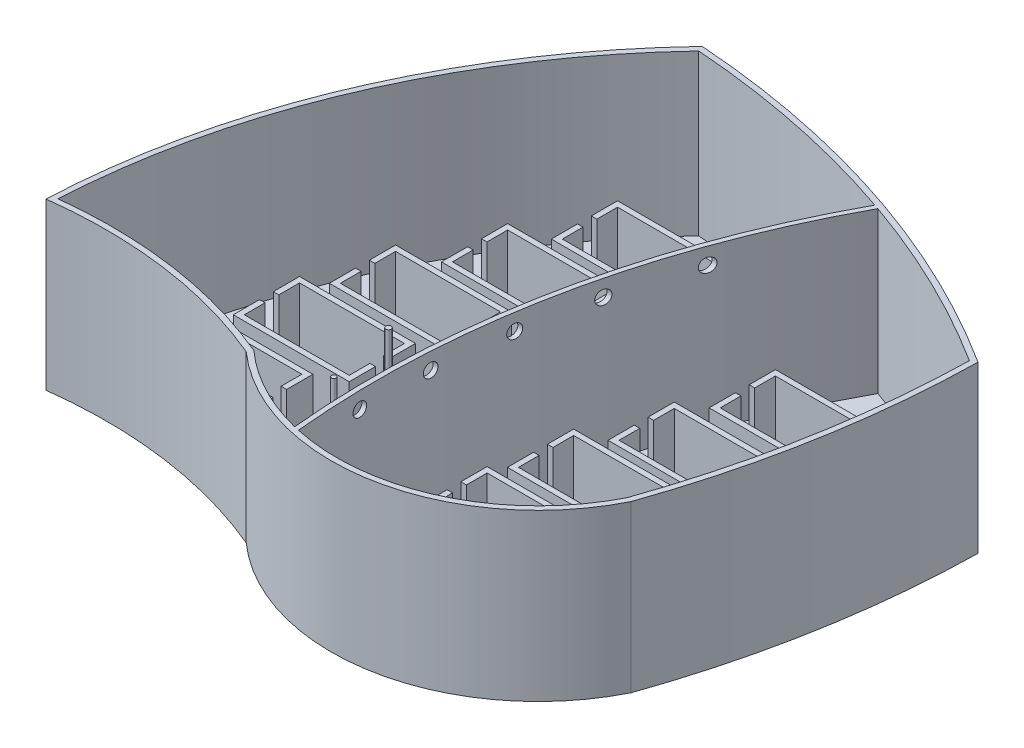
from build123d import *

# Parameters (mm, degrees)
BOSS_EXTRUDE1_DEPTH                 = 38.1
CUT_EXTRUDE1_DEPTH                  = 36.83
BOSS_EXTRUDE2_DEPTH                 = 13.97
BOSS_EXTRUDE3_DEPTH                 = 13.97
BOSS_EXTRUDE4_DEPTH                 = 13.97
BOSS_EXTRUDE5_DEPTH                 = 13.97
BOSS_EXTRUDE6_DEPTH                 = 13.97
BOSS_EXTRUDE7_DEPTH                 = 13.97
BOSS_EXTRUDE8_DEPTH                 = 13.97
BOSS_EXTRUDE9_DEPTH                 = 13.97
BOSS_EXTRUDE10_DEPTH                = 13.97
BOSS_EXTRUDE11_DEPTH                = 13.97
SKETCH23_R                          = 0.528906431
SKETCH23_R_2                        = 0.615796914
DIVIDER_FOR_BACK_RANK_TENDONS_DEPTH = 36.83
SKETCH24_R                          = 1.5875
BACK_RANK_HOLES_DEPTH               = 25.4


with BuildPart() as part:
    # Sketch2 → Boss-Extrude1 (new body)
    with BuildSketch(Plane(origin=(0, 0, 0), x_dir=(1, 0, 0), z_dir=(0, 1, 0))):
        with BuildLine():
            ThreePointArc((69.85, 32.318633901), (24.487599366, 53.834392461), (-24.779542712, 63.5))
            ThreePointArc((-24.779542712, 63.5), (-56.921960183, 14.649560977), (-69.85, -42.379959275))
            ThreePointArc((-69.85, -42.379959275), (-42.648219696, -42.533803265), (-16.422067996, -49.755263412))
            ThreePointArc((-16.422067996, -49.755263412), (24.190420795, -60.863388539), (57.709194094, -35.382875864))
            ThreePointArc((57.709194094, -35.382875864), (66.491147348, -2.018379058), (69.85, 32.318633901))
        make_face()
    extrude(amount=BOSS_EXTRUDE1_DEPTH)

    # Sketch3 → Cut-Extrude1 (cut)
    with BuildSketch(Plane(origin=(0, 38.1, 0), x_dir=(1, 0, 0), z_dir=(0, 1, 0))):
        with BuildLine():
            ThreePointArc((-68.509424991, -40.941161108), (-55.576860209, 14.565343441), (-24.271393384, 62.190872582))
            ThreePointArc((-24.271393384, 62.190872582), (24.035828478, 52.646076911), (68.566503666, 31.629184282))
            ThreePointArc((68.566503666, 31.629184282), (65.177968079, -2.144518661), (56.510759544, -34.962572841))
            ThreePointArc((56.510759544, -34.962572841), (23.756832183, -59.663746327), (-15.762594325, -48.65544684))
            ThreePointArc((-15.762594325, -48.65544684), (-41.638215999, -41.394613893), (-68.509424991, -40.941161108))
        make_face()
    extrude(amount=-CUT_EXTRUDE1_DEPTH, mode=Mode.SUBTRACT)

    # Sketch6 → Boss-Extrude2 (add)
    with BuildSketch(Plane(origin=(0, 0, 0), x_dir=(1, 0, 0), z_dir=(0, 1, 0))):
        Polygon((-55.045108711, -31.662350048), (-53.775108711, -31.662350048), (-53.775108711, -36.424850048), (-29.645108711, -36.424850048), (-29.645108711, -31.662350048), (-28.375108711, -31.662350048), (-28.375108711, -37.694850048), (-55.045108711, -37.694850048), align=None)
        Polygon((-29.645108711, -23.724850048), (-53.775108711, -23.724850048), (-53.775108711, -28.487350048), (-55.045108711, -28.487350048), (-55.045108711, -22.454850048), (-28.375108711, -22.454850048), (-28.375108711, -28.487350048), (-29.645108711, -28.487350048), align=None)
    extrude(amount=BOSS_EXTRUDE2_DEPTH)

    # Sketch7 → Boss-Extrude3 (add)
    with BuildSketch(Plane(origin=(0, 0, 0), x_dir=(1, 0, 0), z_dir=(0, 1, 0))):
        Polygon((-49.383682234, -13.731797044), (-48.113682234, -13.731797044), (-48.113682234, -18.494297044), (-23.983682234, -18.494297044), (-23.983682234, -13.731797044), (-22.713682234, -13.731797044), (-22.713682234, -19.764297044), (-49.383682234, -19.764297044), align=None)
        Polygon((-23.983682234, -5.794297044), (-48.113682234, -5.794297044), (-48.113682234, -10.556797044), (-49.383682234, -10.556797044), (-49.383682234, -4.524297044), (-22.713682234, -4.524297044), (-22.713682234, -10.556797044), (-23.983682234, -10.556797044), align=None)
    extrude(amount=BOSS_EXTRUDE3_DEPTH)

    # Sketch15 → Boss-Extrude4 (add)
    with BuildSketch(Plane.XZ):
        Polygon((-44.6082011, -6.770843976), (-43.3382011, -6.770843976), (-43.3382011, -11.533343976), (-19.2082011, -11.533343976), (-19.2082011, -6.770843976), (-17.9382011, -6.770843976), (-17.9382011, -12.803343976), (-44.6082011, -12.803343976), align=None)
        Polygon((-19.2082011, 1.166656024), (-43.3382011, 1.166656024), (-43.3382011, -3.595843976), (-44.6082011, -3.595843976), (-44.6082011, 2.436656024), (-17.9382011, 2.436656024), (-17.9382011, -3.595843976), (-19.2082011, -3.595843976), align=None)
    extrude(amount=-BOSS_EXTRUDE4_DEPTH)

    # Sketch16 → Boss-Extrude5 (add)
    with BuildSketch(Plane.XZ):
        Polygon((-35.979810024, -23.921981119), (-34.709810024, -23.921981119), (-34.709810024, -28.684481119), (-10.579810024, -28.684481119), (-10.579810024, -23.921981119), (-9.309810024, -23.921981119), (-9.309810024, -29.954481119), (-35.979810024, -29.954481119), align=None)
        Polygon((-10.579810024, -15.984481119), (-34.709810024, -15.984481119), (-34.709810024, -20.746981119), (-35.979810024, -20.746981119), (-35.979810024, -14.714481119), (-9.309810024, -14.714481119), (-9.309810024, -20.746981119), (-10.579810024, -20.746981119), align=None)
    extrude(amount=-BOSS_EXTRUDE5_DEPTH)

    # Sketch17 → Boss-Extrude6 (add)
    with BuildSketch(Plane.XZ):
        Polygon((-27.886567226, -41.10818765), (-26.616567226, -41.10818765), (-26.616567226, -45.87068765), (-2.486567226, -45.87068765), (-2.486567226, -41.10818765), (-1.216567226, -41.10818765), (-1.216567226, -47.14068765), (-27.886567226, -47.14068765), align=None)
        Polygon((-2.486567226, -33.17068765), (-26.616567226, -33.17068765), (-26.616567226, -37.93318765), (-27.886567226, -37.93318765), (-27.886567226, -31.90068765), (-1.216567226, -31.90068765), (-1.216567226, -37.93318765), (-2.486567226, -37.93318765), align=None)
    extrude(amount=-BOSS_EXTRUDE6_DEPTH)

    # Sketch18 → Boss-Extrude7 (add)
    with BuildSketch(Plane.XZ):
        Polygon((10.064145432, 42.807085251), (11.334145432, 42.807085251), (11.334145432, 38.044585251), (35.464145432, 38.044585251), (35.464145432, 42.807085251), (36.734145432, 42.807085251), (36.734145432, 36.774585251), (10.064145432, 36.774585251), align=None)
        Polygon((35.464145432, 50.744585251), (11.334145432, 50.744585251), (11.334145432, 45.982085251), (10.064145432, 45.982085251), (10.064145432, 52.014585251), (36.734145432, 52.014585251), (36.734145432, 45.982085251), (35.464145432, 45.982085251), align=None)
    extrude(amount=-BOSS_EXTRUDE7_DEPTH)

    # Sketch19 → Boss-Extrude8 (add)
    with BuildSketch(Plane.XZ):
        Polygon((10.061287038, 26.851944338), (11.331287038, 26.851944338), (11.331287038, 22.089444338), (35.461287038, 22.089444338), (35.461287038, 26.851944338), (36.731287038, 26.851944338), (36.731287038, 20.819444338), (10.061287038, 20.819444338), align=None)
        Polygon((35.461287038, 34.789444338), (11.331287038, 34.789444338), (11.331287038, 30.026944338), (10.061287038, 30.026944338), (10.061287038, 36.059444338), (36.731287038, 36.059444338), (36.731287038, 30.026944338), (35.461287038, 30.026944338), align=None)
    extrude(amount=-BOSS_EXTRUDE8_DEPTH)

    # Sketch20 → Boss-Extrude9 (add)
    with BuildSketch(Plane.XZ):
        Polygon((12.546150911, 9.425277702), (13.816150911, 9.425277702), (13.816150911, 4.662777702), (37.946150911, 4.662777702), (37.946150911, 9.425277702), (39.216150911, 9.425277702), (39.216150911, 3.392777702), (12.546150911, 3.392777702), align=None)
        Polygon((37.946150911, 17.362777702), (13.816150911, 17.362777702), (13.816150911, 12.600277702), (12.546150911, 12.600277702), (12.546150911, 18.632777702), (39.216150911, 18.632777702), (39.216150911, 12.600277702), (37.946150911, 12.600277702), align=None)
    extrude(amount=-BOSS_EXTRUDE9_DEPTH)

    # Sketch21 → Boss-Extrude10 (add)
    with BuildSketch(Plane.XZ):
        Polygon((18.727563529, -7.53819307), (19.997563529, -7.53819307), (19.997563529, -12.30069307), (44.127563529, -12.30069307), (44.127563529, -7.53819307), (45.397563529, -7.53819307), (45.397563529, -13.57069307), (18.727563529, -13.57069307), align=None)
        Polygon((44.127563529, 0.39930693), (19.997563529, 0.39930693), (19.997563529, -4.36319307), (18.727563529, -4.36319307), (18.727563529, 1.66930693), (45.397563529, 1.66930693), (45.397563529, -4.36319307), (44.127563529, -4.36319307), align=None)
    extrude(amount=-BOSS_EXTRUDE10_DEPTH)

    # Sketch22 → Boss-Extrude11 (add)
    with BuildSketch(Plane.XZ):
        Polygon((23.901443592, -25.632561894), (25.171443592, -25.632561894), (25.171443592, -30.395061894), (49.301443592, -30.395061894), (49.301443592, -25.632561894), (50.571443592, -25.632561894), (50.571443592, -31.665061894), (23.901443592, -31.665061894), align=None)
        Polygon((49.301443592, -17.695061894), (25.171443592, -17.695061894), (25.171443592, -22.457561894), (23.901443592, -22.457561894), (23.901443592, -16.425061894), (50.571443592, -16.425061894), (50.571443592, -22.457561894), (49.301443592, -22.457561894), align=None)
    extrude(amount=-BOSS_EXTRUDE11_DEPTH)

    # Sketch23 → Divider for Back Rank tendons (add)
    with BuildSketch(Plane(origin=(0, 38.1, 0), x_dir=(1, 0, 0), z_dir=(0, 1, 0))):
        with Locations((-1.346916004, -44.664744257)):
            Circle(SKETCH23_R)
        with Locations((-4.825574038, -28.610152479)):
            Circle(SKETCH23_R_2)
        with BuildLine():
            ThreePointArc((5.240622892, -59.403188175), (8.153483226, -2.315240326), (27.743186379, 51.385430763))
            ThreePointArc((27.743186379, 51.385430763), (27.235117894, 51.611315014), (26.696547198, 51.749513734))
            ThreePointArc((26.696547198, 51.749513734), (7.100840536, -2.005307202), (4.11663299, -59.142571739))
            ThreePointArc((4.11663299, -59.142571739), (4.65983635, -59.353924571), (5.240622892, -59.403188175))
        make_face()
    extrude(amount=-DIVIDER_FOR_BACK_RANK_TENDONS_DEPTH)

    # Sketch24 → Back Rank HOles (cut)
    with BuildSketch(Plane(origin=(0, 0, 0), x_dir=(0, 0, -1), z_dir=(1, 0, 0))):
        with Locations((-44.394585251, 34.29)):
            Circle(SKETCH24_R)
        with Locations((-28.439444338, 34.29)):
            Circle(SKETCH24_R)
        with Locations((-11.012777702, 34.29)):
            Circle(SKETCH24_R)
        with Locations((5.95069307, 34.29)):
            Circle(SKETCH24_R)
        with Locations((24.357102673, 34.29)):
            Circle(SKETCH24_R)
    extrude(amount=BACK_RANK_HOLES_DEPTH, mode=Mode.SUBTRACT)


solid = part.part
